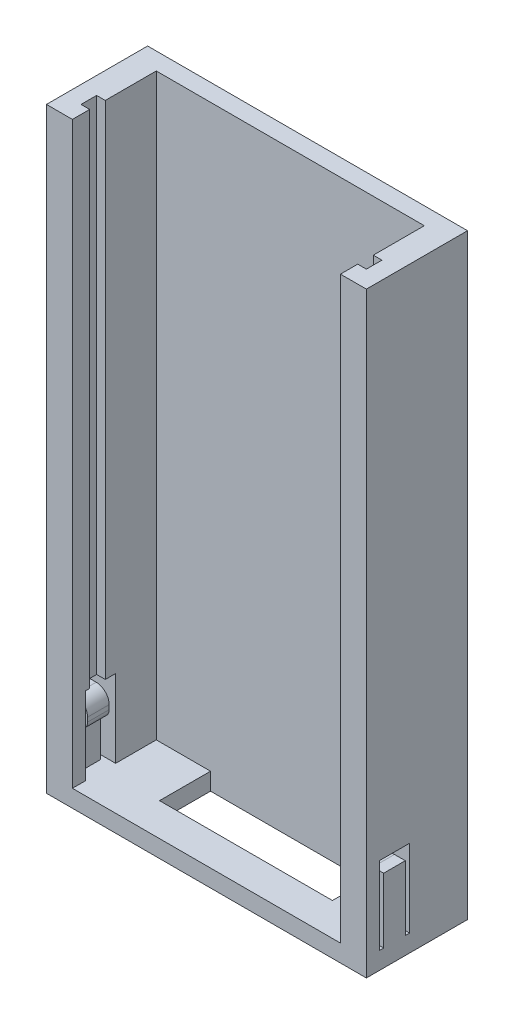
from build123d import *

# Parameters (mm, degrees)
SKETCH1_W           = 37
SKETCH1_H           = 11.7
BOSS_EXTRUDE1_DEPTH = 69
CUT_EXTRUDE1_DEPTH  = 67
SKETCH3_W           = 20
SKETCH3_H           = 5.9
CUT_EXTRUDE2_DEPTH  = 67
SKETCH4_R           = 1.9
BOSS_EXTRUDE2_DEPTH = 3
FILLET1_R           = 2
SKETCH5_W           = 3.5
SKETCH5_H           = 9
CUT_EXTRUDE3_DEPTH  = 40
BOSS_EXTRUDE3_START = 0.5
BOSS_EXTRUDE3_DEPTH = 2.5


with BuildPart() as part:
    # Sketch1 → Boss-Extrude1 (new body)
    with BuildSketch(Plane(origin=(0, 0, 0), x_dir=(1, 0, 0), z_dir=(0, 1, 0))):
        with Locations((18.5, 5.85)):
            Rectangle(SKETCH1_W, SKETCH1_H)
    extrude(amount=BOSS_EXTRUDE1_DEPTH)

    # Sketch2 → Cut-Extrude1 (cut)
    with BuildSketch(Plane(origin=(0, 69, 0), x_dir=(1, 0, 0), z_dir=(0, 1, 0))):
        Polygon((3, 0), (3, 2), (2, 2), (2, 3.8), (3, 3.8), (3, 9.7), (34, 9.7), (34, 3.8), (35, 3.8), (35, 2), (34, 2), (34, 0), align=None)
    extrude(amount=-CUT_EXTRUDE1_DEPTH, mode=Mode.SUBTRACT)

    # Sketch3 → Cut-Extrude2 (cut)
    with BuildSketch(Plane(origin=(0, 2, 0), x_dir=(1, 0, 0), z_dir=(0, 1, 0))):
        with Locations((19.275, 6.75)):
            Rectangle(SKETCH3_W, SKETCH3_H)
    extrude(amount=-CUT_EXTRUDE2_DEPTH, mode=Mode.SUBTRACT)

    # Sketch4 → Boss-Extrude2 (add)
    # profile 1 of 2: a face of its own
    with BuildSketch(Plane(origin=(48.7, 0, -11.7), x_dir=(-1, 0, 0), z_dir=(0, 0, -1))):
        with BuildLine():
            Line((48.7, 55.9), (52.5, 55.9))
            ThreePointArc((52.5, 55.9), (56.4, 52), (52.5, 48.1))
            Line((52.5, 48.1), (48.7, 48.1))
            Line((48.7, 48.1), (48.7, 55.9))
        make_face()
        with Locations((52.5, 52)):
            Circle(SKETCH4_R, mode=Mode.SUBTRACT)
    # profile 2 of 2: a face of its own
    with BuildSketch(Plane(origin=(48.7, 0, -11.7), x_dir=(-1, 0, 0), z_dir=(0, 0, -1))):
        with BuildLine():
            Line((48.7, 19.9), (52.5, 19.9))
            ThreePointArc((52.5, 19.9), (56.4, 16), (52.5, 12.1))
            Line((52.5, 12.1), (48.7, 12.1))
            Line((48.7, 12.1), (48.7, 19.9))
        make_face()
        with Locations((52.5, 16)):
            Circle(SKETCH4_R, mode=Mode.SUBTRACT)
    extrude(amount=-BOSS_EXTRUDE2_DEPTH)

    # Fillet1
    fillet1_edges = [part.edges().sort_by_distance(p)[0] for p in [
        (0, 12.1, -10.2),
        (0, 48.1, -10.2),
        (0, 19.9, -10.2),
        (0, 55.9, -10.2),
    ]]
    fillet(fillet1_edges, radius=FILLET1_R)

    # Sketch5 → Cut-Extrude3 (cut)
    with BuildSketch(Plane(origin=(37, 0, 0), x_dir=(0, 0, -1), z_dir=(1, 0, 0))):
        with Locations((3.25, 6.5)):
            Rectangle(SKETCH5_W, SKETCH5_H)
    extrude(amount=-CUT_EXTRUDE3_DEPTH, mode=Mode.SUBTRACT)

    # Sketch6 → Boss-Extrude3 (add)
    with BuildSketch(Plane(origin=(0, 0, -1.5), x_dir=(-1, 0, 0), z_dir=(0, 0, -1)).offset(BOSS_EXTRUDE3_START)):
        with BuildLine():
            Line((0, 2), (0, 9.5))
            Line((0, 9.5), (-1.25, 9.5))
            ThreePointArc((-1.25, 9.5), (-2.310660172, 9.060660172), (-2.75, 8))
            Line((-2.75, 8), (-2.75, 7.5))
            ThreePointArc((-2.75, 7.5), (-2.457106781, 6.792893219), (-1.75, 6.5))
            Line((-1.75, 6.5), (-1.75, 2))
            Line((-1.75, 2), (0, 2))
        make_face()
    boss_extrude3 = extrude(amount=BOSS_EXTRUDE3_DEPTH)

    # Mirror1: Boss-Extrude3 across plane
    add(boss_extrude3.mirror(Plane.ZY.offset(-18.5)))


solid = part.part
